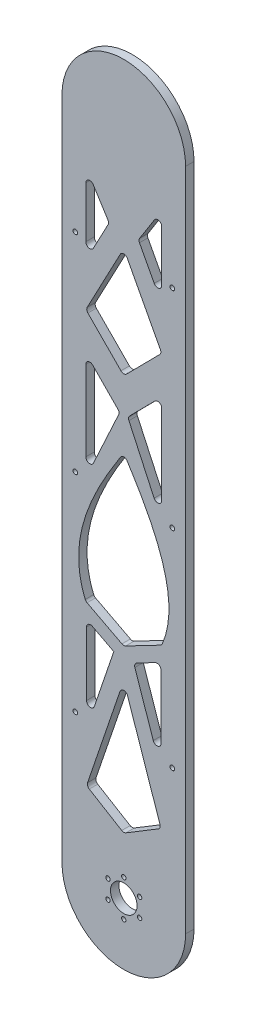
from build123d import *

# Parameters (mm, degrees)
SKETCH2_R           = 10
SKETCH2_R_2         = 1.65
BOSS_EXTRUDE1_DEPTH = 6.35
CUT_EXTRUDE1_DEPTH  = 10
FILLET3_R           = 3
SKETCH5_R           = 1.75
CUT_EXTRUDE2_DEPTH  = 549.511460792


with BuildPart() as part:
    # Sketch2 → Boss-Extrude1 (new body)
    with BuildSketch(Plane.XY):
        with BuildLine():
            Line((-46.5, 0), (-46.5, 500))
            ThreePointArc((-46.5, 500), (0, 546.5), (46.5, 500))
            Line((46.5, 500), (46.5, 0))
            ThreePointArc((46.5, 0), (0, -46.5), (-46.5, 0))
        make_face()
        Circle(SKETCH2_R, mode=Mode.SUBTRACT)
        with Locations((0, 13.75)):
            Circle(SKETCH2_R_2, mode=Mode.SUBTRACT)
        with Locations((11.907849302, 6.875)):
            Circle(SKETCH2_R_2, mode=Mode.SUBTRACT)
        with Locations((11.907849302, -6.875)):
            Circle(SKETCH2_R_2, mode=Mode.SUBTRACT)
        with Locations((0, -13.75)):
            Circle(SKETCH2_R_2, mode=Mode.SUBTRACT)
        with Locations((-11.907849302, -6.875)):
            Circle(SKETCH2_R_2, mode=Mode.SUBTRACT)
        with Locations((-11.907849302, 6.875)):
            Circle(SKETCH2_R_2, mode=Mode.SUBTRACT)
    extrude(amount=BOSS_EXTRUDE1_DEPTH)

    # Sketch4 → Cut-Extrude1 (cut)
    with BuildSketch(Plane.XY.offset(6.35)):
        Polygon((28.005258112, 59.37595418), (0, 42.411661153), (-28.005258112, 59.37595418), (0, 141.693437584), align=None)
        Polygon((-7.5, 156.905935087), (-28.005258112, 96.633637735), (-28.005258112, 167.582877854), align=None)
        Polygon((28.005258112, 167.582877854), (7.5, 156.905935087), (28.005258112, 96.633637735), align=None)
        with BuildLine():
            Line((0, 164.275138905), (28.550546746, 179.141206521))
            add(Edge.make_bspline(
                [(28.550546746, 179.141206521), (45.32025339, 216.985654627), (19.430092874, 259.790255689), (0, 290.025756679)],
                knots=[0, 0, 0, 0, 1, 1, 1, 1], degree=3))
            add(Edge.make_bspline(
                [(-28.550546746, 179.141206521), (-45.32025339, 216.985654627), (-19.430092874, 259.790255689), (0, 290.025756679)],
                knots=[0, 0, 0, 0, 1, 1, 1, 1], degree=3))
            Line((-28.550546746, 179.141206521), (0, 164.275138905))
        make_face()
        Polygon((28.550546746, 259.58677623), (3, 314.938284003), (28.550546746, 340.793051053), align=None)
        Polygon((-3, 314.938284003), (-28.550546746, 340.793051053), (-28.550546746, 259.58677623), align=None)
        Polygon((0, 423.142843498), (-28.550546746, 369.246205395), (0, 340.355718526), (28.550546746, 369.246205395), align=None)
        Polygon((-28.550546746, 462.095190817), (-28.550546746, 401.290241252), (-11, 434.421497018), align=None)
        Polygon((28.550546746, 401.290241252), (11, 434.421497018), (28.550546746, 462.095190817), align=None)
    extrude(amount=-CUT_EXTRUDE1_DEPTH, mode=Mode.SUBTRACT)

    # Fillet3
    fillet3_edges = [part.edges().sort_by_distance(p)[0] for p in [
        (-11, 434.421497018, 3.175),
        (-28.550546746, 401.290241252, 3.175),
        (28.550546746, 401.290241252, 3.175),
        (11, 434.421497018, 3.175),
        (28.550546746, 462.095190817, 3.175),
        (-28.550546746, 462.095190817, 3.175),
        (0, 423.142843498, 3.175),
        (-28.550546746, 369.246205395, 3.175),
        (28.550546746, 369.246205395, 3.175),
        (0, 340.355718526, 3.175),
        (28.550546746, 340.793051053, 3.175),
        (-28.550546746, 340.793051053, 3.175),
        (-3, 314.938284003, 3.175),
        (3, 314.938284003, 3.175),
        (28.550546746, 259.58677623, 3.175),
        (-28.550546746, 259.58677623, 3.175),
        (28.550546746, 179.141206521, 3.175),
        (0, 290.025756679, 3.175),
        (-28.550546746, 179.141206521, 3.175),
        (0, 164.275138905, 3.175),
        (-28.005258112, 96.633637735, 3.175),
        (28.005258112, 96.633637735, 3.175),
        (7.5, 156.905935087, 3.175),
        (-28.005258112, 167.582877854, 3.175),
        (28.005258112, 167.582877854, 3.175),
        (0, 141.693437584, 3.175),
        (28.005258112, 59.37595418, 3.175),
        (-28.005258112, 59.37595418, 3.175),
        (0, 42.411661153, 3.175),
    ]]
    fillet(fillet3_edges, radius=FILLET3_R)

    # Sketch5 → Cut-Extrude2 (cut, through all)
    with BuildSketch(Plane.XY.offset(6.35)):
        with Locations((36.5, 103.175)):
            Circle(SKETCH5_R)
        with Locations((-36.5, 103.175)):
            Circle(SKETCH5_R)
        with Locations((36.5, 259.525)):
            Circle(SKETCH5_R)
        with Locations((-36.5, 259.525)):
            Circle(SKETCH5_R)
        with Locations((36.5, 415.875)):
            Circle(SKETCH5_R)
        with Locations((-36.5, 415.875)):
            Circle(SKETCH5_R)
    extrude(amount=-CUT_EXTRUDE2_DEPTH, mode=Mode.SUBTRACT)


solid = part.part
